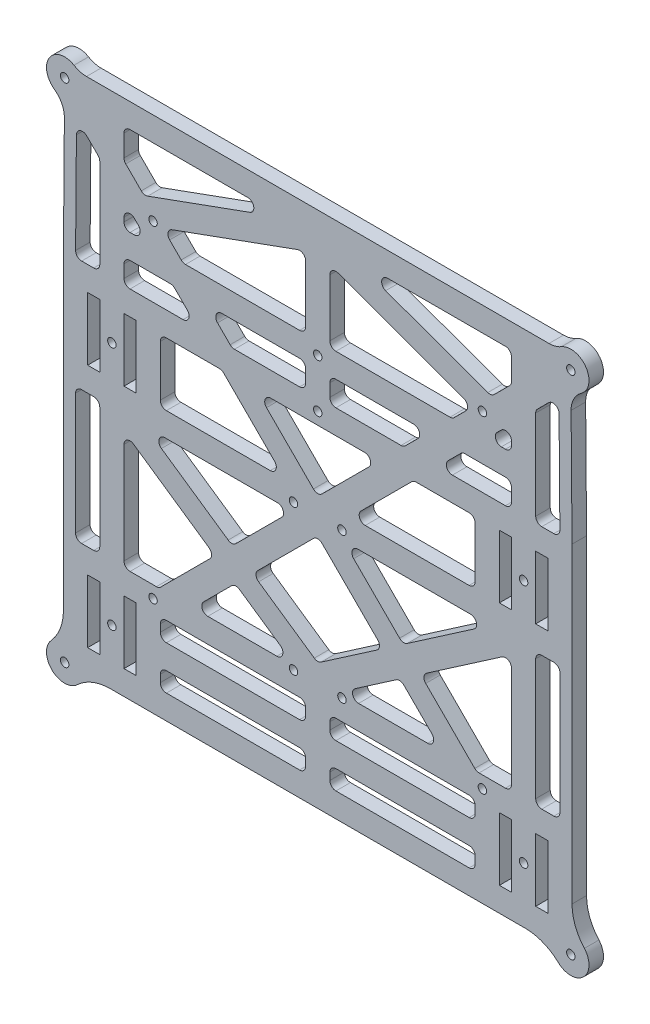
from build123d import *

# Parameters (mm, degrees)
SZKIC3_W                      = 10
SZKIC3_H                      = 209
DODANIE_WYCI_GNI_CIE1_DEPTH   = 6
DODANIE_WYCI_GNI_CIE1_2_DEPTH = 6
SZKIC4_W                      = 190
SZKIC4_H                      = 10
DODANIE_WYCI_GNI_CIE2_DEPTH   = 6
SZKIC5_W                      = 10
SZKIC5_H                      = 26
DODANIE_WYCI_GNI_CIE3_DEPTH   = 6
SZKIC6_W                      = 10
SZKIC6_H                      = 46
DODANIE_WYCI_GNI_CIE4_DEPTH   = 6
SZKIC7_R                      = 7.5
DODANIE_WYCI_GNI_CIE5_DEPTH   = 6
ZAOKR_GLENIE1_R               = 20
SZKIC8_R                      = 7.5
DODANIE_WYCI_GNI_CIE6_DEPTH   = 6
DODANIE_WYCI_GNI_CIE6_2_DEPTH = 6
SZKIC9_W                      = 209
SZKIC9_H                      = 10
DODANIE_WYCI_GNI_CIE7_DEPTH   = 6
DODANIE_WYCI_GNI_CIE8_DEPTH   = 6
SZKIC11_W                     = 160
SZKIC11_H                     = 10
SZKIC11_W_2                   = 130
DODANIE_WYCI_GNI_CIE9_DEPTH   = 6
DODANIE_WYCI_GNI_CIE10_DEPTH  = 6
DODANIE_WYCI_GNI_CIE11_DEPTH  = 6
SZKIC14_W                     = 4.999837417
SZKIC14_H                     = 55
DODANIE_WYCI_GNI_CIE12_DEPTH  = 6
SZKIC15_W                     = 10
SZKIC15_H                     = 51.681071281
DODANIE_WYCI_GNI_CIE13_DEPTH  = 6
SZKIC16_W                     = 10
SZKIC16_H                     = 26
DODANIE_WYCI_GNI_CIE14_DEPTH  = 6
DODANIE_WYCI_GNI_CIE15_DEPTH  = 6
ZAOKR_GLENIE2_R               = 2.5
ZAOKR_GLENIE3_R               = 10
WYTNIJ_WYCI_GNI_CIE1_REACH    = 160.506
SZKIC1_R                      = 1.75
WYTNIJ_WYCI_GNI_CIE2_REACH    = 160.506
SZKIC18_R                     = 1.75
WYTNIJ_WYCI_GNI_CIE3_REACH    = 160.506
SZKIC19_R                     = 1.75
WYTNIJ_WYCI_GNI_CIE4_REACH    = 160.506
SZKIC20_R                     = 1.75


with BuildPart() as part:
    # Szkic3 → Dodanie-wyciągnięcie1 (new body)
    with BuildSketch(Plane.XY):
        with Locations((-85, 0)):
            Rectangle(SZKIC3_W, SZKIC3_H)
    extrude(amount=DODANIE_WYCI_GNI_CIE1_DEPTH)



with BuildPart() as body_2:
    # Szkic3 → Dodanie-wyci_gni_cie1 2 (new body)
    with BuildSketch(Plane.XY):
        with Locations((85, 0)):
            Rectangle(SZKIC3_W, SZKIC3_H)
    extrude(amount=DODANIE_WYCI_GNI_CIE1_2_DEPTH)


with BuildPart() as part_1:
    add(part.part)

    add(body_2.part)  # Dodanie-wyciągnięcie2 merges body 2
    # Szkic4 → Dodanie-wyciągnięcie2 (add)
    with BuildSketch(Plane.XY):
        with Locations((0, -99.5)):
            Rectangle(SZKIC4_W, SZKIC4_H)
        with Locations((0, -63.5)):
            Rectangle(SZKIC4_W, SZKIC4_H)
        with Locations((0, 1.5)):
            Rectangle(SZKIC4_W, SZKIC4_H)
        with Locations((0, 37.5)):
            Rectangle(SZKIC4_W, SZKIC4_H)
    extrude(amount=DODANIE_WYCI_GNI_CIE2_DEPTH)

    # Szkic5 → Dodanie-wyciągnięcie3 (add)
    with BuildSketch(Plane.XY.offset(6)):
        with Locations((-70, -81.5)):
            Rectangle(SZKIC5_W, SZKIC5_H)
        with Locations((-70, 19.5)):
            Rectangle(SZKIC5_W, SZKIC5_H)
        with Locations((70, 19.5)):
            Rectangle(SZKIC5_W, SZKIC5_H)
        with Locations((70, -81.5)):
            Rectangle(SZKIC5_W, SZKIC5_H)
    extrude(amount=-DODANIE_WYCI_GNI_CIE3_DEPTH)

    # Szkic6 → Dodanie-wyciągnięcie4 (add)
    with BuildSketch(Plane.XY):
        with Locations((-100, 19.5)):
            Rectangle(SZKIC6_W, SZKIC6_H)
        with Locations((-100, -81.5)):
            Rectangle(SZKIC6_W, SZKIC6_H)
        with Locations((100, -81.5)):
            Rectangle(SZKIC6_W, SZKIC6_H)
        with Locations((100, 19.5)):
            Rectangle(SZKIC6_W, SZKIC6_H)
    extrude(amount=DODANIE_WYCI_GNI_CIE4_DEPTH)

    # Szkic7 → Dodanie-wyciągnięcie5 (add)
    with BuildSketch(Plane.XY.offset(6)):
        with Locations((-104.5, -104.5)):
            Circle(SZKIC7_R)
        with Locations((104.5, -104.5)):
            Circle(SZKIC7_R)
    extrude(amount=-DODANIE_WYCI_GNI_CIE5_DEPTH)

    # Zaokrąglenie1
    zaokr_glenie1_edges = [part_1.edges().sort_by_distance(p)[0] for p in [
        (-105, -97.016685226, 3),
        (-97, -104.5, 3),
        (105, -97.016685226, 3),
        (97, -104.5, 3),
    ]]
    fillet(zaokr_glenie1_edges, radius=ZAOKR_GLENIE1_R)



with BuildPart() as body_2_2:
    # Szkic8 → Dodanie-wyciągnięcie6 (new body)
    with BuildSketch(Plane.XY.offset(6)):
        with Locations((-104.5, 104.5)):
            Circle(SZKIC8_R)
    extrude(amount=-DODANIE_WYCI_GNI_CIE6_DEPTH)


with BuildPart() as body_3:
    # Szkic8 → Dodanie-wyci_gni_cie6 2 (new body)
    with BuildSketch(Plane.XY.offset(6)):
        with Locations((104.5, 104.5)):
            Circle(SZKIC8_R)
    extrude(amount=-DODANIE_WYCI_GNI_CIE6_2_DEPTH)


with BuildPart() as part_2:
    add(part_1.part)

    add(body_2_2.part)  # Dodanie-wyciągnięcie7 merges body 2 2

    add(body_3.part)  # Dodanie-wyciągnięcie7 merges body 3
    # Szkic9 → Dodanie-wyciągnięcie7 (add)
    with BuildSketch(Plane.XY):
        with Locations((0, 104.5)):
            Rectangle(SZKIC9_W, SZKIC9_H)
    extrude(amount=DODANIE_WYCI_GNI_CIE7_DEPTH)

    # Szkic10 → Dodanie-wyciągnięcie8 (add)
    with BuildSketch(Plane.XY):
        Polygon((-100.964466094, 108.035533906), (-108.035533906, 100.964466094), (-7.071067812, 0), (0, 7.071067812), align=None)
        Polygon((100.964466094, 108.035533906), (0, 7.071067812), (7.071067812, 0), (108.035533906, 100.964466094), align=None)
        Polygon((0, -7.071067812), (-7.071067812, 0), (-65.571067812, -58.5), (-51.428932188, -58.5), align=None)
        Polygon((0, 7.071067812), (-7.071067812, 0), (0, -7.071067812), (7.071067812, 0), align=None)
        Polygon((7.071067812, 0), (0, -7.071067812), (51.428932188, -58.5), (65.571067812, -58.5), align=None)
    extrude(amount=DODANIE_WYCI_GNI_CIE8_DEPTH)

    # Szkic11 → Dodanie-wyciągnięcie9 (add)
    with BuildSketch(Plane(origin=(0, 0, 0), x_dir=(-1, 0, 0), z_dir=(0, 0, -1))):
        with Locations((0, 57.714466094)):
            Rectangle(SZKIC11_W, SZKIC11_H)
        with Locations((0, -81.5)):
            Rectangle(SZKIC11_W_2, SZKIC11_H)
    extrude(amount=-DODANIE_WYCI_GNI_CIE9_DEPTH)

    # Szkic12 → Dodanie-wyciągnięcie10 (add)
    with BuildSketch(Plane(origin=(0, 0, 0), x_dir=(-1, 0, 0), z_dir=(0, 0, -1))):
        Polygon((-82.832644114, -7.620209621), (0, -64.56765245), (82.832644114, -7.620209621), (77.167355886, 0.620209621), (0, -52.43234755), (-77.167355886, 0.620209621), align=None)
    extrude(amount=-DODANIE_WYCI_GNI_CIE10_DEPTH)

    # Szkic13 → Dodanie-wyciągnięcie11 (add)
    with BuildSketch(Plane(origin=(0, 0, 0), x_dir=(-1, 0, 0), z_dir=(0, 0, -1))):
        Polygon((-63.918821819, 70.989889631), (0, 94.181071281), (63.918821819, 70.989889631), (71.724576463, 78.795644275), (0, 104.818928719), (-71.724576463, 78.795644275), align=None)
    extrude(amount=-DODANIE_WYCI_GNI_CIE11_DEPTH)

    # Szkic14 → Dodanie-wyciągnięcie12 (add)
    with BuildSketch(Plane(origin=(0, 0, 0), x_dir=(-1, 0, 0), z_dir=(0, 0, -1))):
        Polygon((99.500162583, 104.459678731), (100.000162583, 42.459678731), (105, 42.5), (104.5, 104.5), align=None)
        Polygon((-99.500162583, 104.459678731), (-100.000162583, 42.459678731), (-105, 42.5), (-104.5, 104.5), align=None)
        with Locations((102.500081292, -31)):
            Rectangle(SZKIC14_W, SZKIC14_H)
        with Locations((-102.500081292, -31)):
            Rectangle(SZKIC14_W, SZKIC14_H)
    extrude(amount=-DODANIE_WYCI_GNI_CIE12_DEPTH)

    # Szkic15 → Dodanie-wyciągnięcie13 (add)
    with BuildSketch(Plane(origin=(0, 0, 0), x_dir=(-1, 0, 0), z_dir=(0, 0, -1))):
        with Locations((0, 68.340535641)):
            Rectangle(SZKIC15_W, SZKIC15_H)
    extrude(amount=-DODANIE_WYCI_GNI_CIE13_DEPTH)

    # Szkic16 → Dodanie-wyciągnięcie14 (add)
    with BuildSketch(Plane(origin=(0, 0, 0), x_dir=(-1, 0, 0), z_dir=(0, 0, -1))):
        with Locations((0, -81.5)):
            Rectangle(SZKIC16_W, SZKIC16_H)
    extrude(amount=-DODANIE_WYCI_GNI_CIE14_DEPTH)

    # Szkic17 → Dodanie-wyciągnięcie15 (add)
    with BuildSketch(Plane.XY.offset(6)):
        Polygon((-90, 97.071067812), (-90, 99.5), (-92.428932188, 99.5), align=None)
        Polygon((92.428932188, 99.5), (90, 99.5), (90, 97.071067812), align=None)
    extrude(amount=-DODANIE_WYCI_GNI_CIE15_DEPTH)

    # Zaokrąglenie2
    zaokr_glenie2_edges = [part_2.edges().sort_by_distance(p)[0] for p in [
        (-5, -76.5, 3),
        (-5, -68.5, 3),
        (5, -76.5, 3),
        (5, -68.5, 3),
        (-5, -94.5, 3),
        (5, -94.5, 3),
        (-90, -3.5, 3),
        (90, -3.5, 3),
        (-90, 42.5, 3),
        (-80, 42.5, 3),
        (80, 42.5, 3),
        (90, 42.5, 3),
        (-65, -68.5, 3),
        (-65, -94.5, 3),
        (-65, 32.5, 3),
        (-65, 6.5, 3),
        (65, 6.5, 3),
        (65, 32.5, 3),
        (65, -94.5, 3),
        (65, -68.5, 3),
        (-80, 99.5, 3),
        (80, 99.5, 3),
        (-10.571067812, -3.5, 3),
        (10.571067812, -3.5, 3),
        (65.571067812, -58.5, 3),
        (0, 7.071067812, 3),
        (-80, 87.071067812, 3),
        (-25.428932188, 32.5, 3),
        (-35.428932188, 42.5, 3),
        (80, 87.071067812, 3),
        (35.428932188, 42.5, 3),
        (25.428932188, 32.5, 3),
        (-90, 82.928932188, 3),
        (-80, 72.928932188, 3),
        (-49.571067812, 42.5, 3),
        (-13.571067812, 6.5, 3),
        (-39.571067812, 32.5, 3),
        (13.571067812, 6.5, 3),
        (80, 72.928932188, 3),
        (90, 82.928932188, 3),
        (39.571067812, 32.5, 3),
        (49.571067812, 42.5, 3),
        (51.428932188, -58.5, 3),
        (0, -7.071067812, 3),
        (-51.428932188, -58.5, 3),
        (-65.571067812, -58.5, 3),
        (90, -58.5, 3),
        (-69.785533906, 62.714466094, 3),
        (-59.785533906, 52.714466094, 3),
        (45.643398282, 52.714466094, 3),
        (-45.643398282, 52.714466094, 3),
        (-80, 52.714466094, 3),
        (55.643398282, 62.714466094, 3),
        (-55.643398282, 62.714466094, 3),
        (-80, 62.714466094, 3),
        (59.785533906, 52.714466094, 3),
        (80, 52.714466094, 3),
        (69.785533906, 62.714466094, 3),
        (80, 62.714466094, 3),
        (65, -86.5, 3),
        (65, -76.5, 3),
        (-65, -76.5, 3),
        (-65, -86.5, 3),
        (34.072050156, -41.143117968, 3),
        (26.880758364, -33.951826175, 3),
        (-34.072050156, -41.143117968, 3),
        (-90, -58.5, 3),
        (-26.880758364, -33.951826175, 3),
        (-80, -58.5, 3),
        (80, -58.5, 3),
        (-71.17432371, -3.5, 3),
        (-35.261283178, -28.190215366, 3),
        (-80, -9.56765245, 3),
        (-42.45257497, -35.381507158, 3),
        (35.261283178, -28.190215366, 3),
        (42.45257497, -35.381507158, 3),
        (8.82567629, -58.5, 3),
        (71.17432371, -3.5, 3),
        (0, -52.43234755, 3),
        (-8.82567629, -58.5, 3),
        (80, -9.56765245, 3),
        (71.724576463, 78.795644275, 3),
        (-63.918821819, 70.989889631, 3),
        (63.918821819, 70.989889631, 3),
        (14.659867798, 99.5, 3),
        (-14.659867798, 99.5, 3),
        (-71.724576463, 78.795644275, 3),
        (99.596407255, 92.525339443, 3),
        (99.999837412, 42.5, 3),
        (-99.596407255, 92.525339443, 3),
        (-99.999837412, 42.5, 3),
        (-100.000162583, -3.5, 3),
        (-100.000162583, -58.5, 3),
        (100.000162583, -58.5, 3),
        (100.000162583, -3.5, 3),
        (5, 92.366959178, 3),
        (-5, 92.366959178, 3),
        (-5, 62.714466094, 3),
        (5, 62.714466094, 3),
        (-5, 52.714466094, 3),
        (-5, 42.5, 3),
        (5, 52.714466094, 3),
        (5, 42.5, 3),
        (5, -86.5, 3),
        (-5, -86.5, 3),
    ]]
    fillet(zaokr_glenie2_edges, radius=ZAOKR_GLENIE2_R)

    # Zaokrąglenie3
    zaokr_glenie3_edges = [part_2.edges().sort_by_distance(p)[0] for p in [
        (-98.909830056, 109.5, 3),
        (98.909830056, 109.5, 3),
        (104.560481904, 97.000243875, 3),
        (-104.560481904, 97.000243875, 3),
    ]]
    fillet(zaokr_glenie3_edges, radius=ZAOKR_GLENIE3_R)

    # Szkic1 → Wytnij-wyciągnięcie1 (cut, up to next)
    with BuildSketch(Plane.XY, mode=Mode.PRIVATE) as wytnij_wyci_gni_cie1_sk1:
        with Locations(Location((-104.5, 104.5, 0), (0, 0, 180))):
            Circle(SZKIC1_R)
    wytnij_wyci_gni_cie1_tool1 = extrude(wytnij_wyci_gni_cie1_sk1.sketch, amount=WYTNIJ_WYCI_GNI_CIE1_REACH, mode=Mode.PRIVATE) & part_2.part
    # Szkic1 → Wytnij-wyciągnięcie1 (cut, up to next)
    with BuildSketch(Plane.XY, mode=Mode.PRIVATE) as wytnij_wyci_gni_cie1_sk2:
        with Locations(Location((104.5, 104.5, 0), (0, 0, 180))):
            Circle(SZKIC1_R)
    wytnij_wyci_gni_cie1_tool2 = extrude(wytnij_wyci_gni_cie1_sk2.sketch, amount=WYTNIJ_WYCI_GNI_CIE1_REACH, mode=Mode.PRIVATE) & part_2.part
    # Szkic1 → Wytnij-wyciągnięcie1 (cut, up to next)
    with BuildSketch(Plane.XY, mode=Mode.PRIVATE) as wytnij_wyci_gni_cie1_sk3:
        with Locations(Location((104.5, -104.5, 0), (0, 0, 180))):
            Circle(SZKIC1_R)
    wytnij_wyci_gni_cie1_tool3 = extrude(wytnij_wyci_gni_cie1_sk3.sketch, amount=WYTNIJ_WYCI_GNI_CIE1_REACH, mode=Mode.PRIVATE) & part_2.part
    # Szkic1 → Wytnij-wyciągnięcie1 (cut, up to next)
    with BuildSketch(Plane.XY, mode=Mode.PRIVATE) as wytnij_wyci_gni_cie1_sk4:
        with Locations(Location((-104.5, -104.5, 0), (0, 0, 180))):
            Circle(SZKIC1_R)
    wytnij_wyci_gni_cie1_tool4 = extrude(wytnij_wyci_gni_cie1_sk4.sketch, amount=WYTNIJ_WYCI_GNI_CIE1_REACH, mode=Mode.PRIVATE) & part_2.part
    add(wytnij_wyci_gni_cie1_tool1.solids().sort_by_distance((-104.5, 104.5, 0))[0], mode=Mode.SUBTRACT)
    add(wytnij_wyci_gni_cie1_tool2.solids().sort_by_distance((104.5, 104.5, 0))[0], mode=Mode.SUBTRACT)
    add(wytnij_wyci_gni_cie1_tool3.solids().sort_by_distance((104.5, -104.5, 0))[0], mode=Mode.SUBTRACT)
    add(wytnij_wyci_gni_cie1_tool4.solids().sort_by_distance((-104.5, -104.5, 0))[0], mode=Mode.SUBTRACT)

    # Szkic18 → Wytnij-wyciągnięcie2 (cut, up to next)
    with BuildSketch(Plane(origin=(0, 0, 0), x_dir=(-1, 0, 0), z_dir=(0, 0, -1)), mode=Mode.PRIVATE) as wytnij_wyci_gni_cie2_sk1:
        with Locations((-68, -63.5)):
            Circle(SZKIC18_R)
    wytnij_wyci_gni_cie2_tool1 = extrude(wytnij_wyci_gni_cie2_sk1.sketch, amount=-WYTNIJ_WYCI_GNI_CIE2_REACH, mode=Mode.PRIVATE) & part_2.part
    # Szkic18 → Wytnij-wyciągnięcie2 (cut, up to next)
    with BuildSketch(Plane(origin=(0, 0, 0), x_dir=(-1, 0, 0), z_dir=(0, 0, -1)), mode=Mode.PRIVATE) as wytnij_wyci_gni_cie2_sk2:
        with Locations((-68, 71.5)):
            Circle(SZKIC18_R)
    wytnij_wyci_gni_cie2_tool2 = extrude(wytnij_wyci_gni_cie2_sk2.sketch, amount=-WYTNIJ_WYCI_GNI_CIE2_REACH, mode=Mode.PRIVATE) & part_2.part
    # Szkic18 → Wytnij-wyciągnięcie2 (cut, up to next)
    with BuildSketch(Plane(origin=(0, 0, 0), x_dir=(-1, 0, 0), z_dir=(0, 0, -1)), mode=Mode.PRIVATE) as wytnij_wyci_gni_cie2_sk3:
        with Locations((68, -63.5)):
            Circle(SZKIC18_R)
    wytnij_wyci_gni_cie2_tool3 = extrude(wytnij_wyci_gni_cie2_sk3.sketch, amount=-WYTNIJ_WYCI_GNI_CIE2_REACH, mode=Mode.PRIVATE) & part_2.part
    # Szkic18 → Wytnij-wyciągnięcie2 (cut, up to next)
    with BuildSketch(Plane(origin=(0, 0, 0), x_dir=(-1, 0, 0), z_dir=(0, 0, -1)), mode=Mode.PRIVATE) as wytnij_wyci_gni_cie2_sk4:
        with Locations((68, 71.5)):
            Circle(SZKIC18_R)
    wytnij_wyci_gni_cie2_tool4 = extrude(wytnij_wyci_gni_cie2_sk4.sketch, amount=-WYTNIJ_WYCI_GNI_CIE2_REACH, mode=Mode.PRIVATE) & part_2.part
    add(wytnij_wyci_gni_cie2_tool1.solids().sort_by_distance((68, -63.5, 0))[0], mode=Mode.SUBTRACT)
    add(wytnij_wyci_gni_cie2_tool2.solids().sort_by_distance((68, 71.5, 0))[0], mode=Mode.SUBTRACT)
    add(wytnij_wyci_gni_cie2_tool3.solids().sort_by_distance((-68, -63.5, 0))[0], mode=Mode.SUBTRACT)
    add(wytnij_wyci_gni_cie2_tool4.solids().sort_by_distance((-68, 71.5, 0))[0], mode=Mode.SUBTRACT)

    # Szkic19 → Wytnij-wyciągnięcie3 (cut, up to next)
    with BuildSketch(Plane(origin=(0, 0, 0), x_dir=(-1, 0, 0), z_dir=(0, 0, -1)), mode=Mode.PRIVATE) as wytnij_wyci_gni_cie3_sk1:
        with Locations((-85, 19.5)):
            Circle(SZKIC19_R)
    wytnij_wyci_gni_cie3_tool1 = extrude(wytnij_wyci_gni_cie3_sk1.sketch, amount=-WYTNIJ_WYCI_GNI_CIE3_REACH, mode=Mode.PRIVATE) & part_2.part
    # Szkic19 → Wytnij-wyciągnięcie3 (cut, up to next)
    with BuildSketch(Plane(origin=(0, 0, 0), x_dir=(-1, 0, 0), z_dir=(0, 0, -1)), mode=Mode.PRIVATE) as wytnij_wyci_gni_cie3_sk2:
        with Locations((85, 19.5)):
            Circle(SZKIC19_R)
    wytnij_wyci_gni_cie3_tool2 = extrude(wytnij_wyci_gni_cie3_sk2.sketch, amount=-WYTNIJ_WYCI_GNI_CIE3_REACH, mode=Mode.PRIVATE) & part_2.part
    # Szkic19 → Wytnij-wyciągnięcie3 (cut, up to next)
    with BuildSketch(Plane(origin=(0, 0, 0), x_dir=(-1, 0, 0), z_dir=(0, 0, -1)), mode=Mode.PRIVATE) as wytnij_wyci_gni_cie3_sk3:
        with Locations((85, -81.5)):
            Circle(SZKIC19_R)
    wytnij_wyci_gni_cie3_tool3 = extrude(wytnij_wyci_gni_cie3_sk3.sketch, amount=-WYTNIJ_WYCI_GNI_CIE3_REACH, mode=Mode.PRIVATE) & part_2.part
    # Szkic19 → Wytnij-wyciągnięcie3 (cut, up to next)
    with BuildSketch(Plane(origin=(0, 0, 0), x_dir=(-1, 0, 0), z_dir=(0, 0, -1)), mode=Mode.PRIVATE) as wytnij_wyci_gni_cie3_sk4:
        with Locations((-85, -81.5)):
            Circle(SZKIC19_R)
    wytnij_wyci_gni_cie3_tool4 = extrude(wytnij_wyci_gni_cie3_sk4.sketch, amount=-WYTNIJ_WYCI_GNI_CIE3_REACH, mode=Mode.PRIVATE) & part_2.part
    add(wytnij_wyci_gni_cie3_tool1.solids().sort_by_distance((85, 19.5, 0))[0], mode=Mode.SUBTRACT)
    add(wytnij_wyci_gni_cie3_tool2.solids().sort_by_distance((-85, 19.5, 0))[0], mode=Mode.SUBTRACT)
    add(wytnij_wyci_gni_cie3_tool3.solids().sort_by_distance((-85, -81.5, 0))[0], mode=Mode.SUBTRACT)
    add(wytnij_wyci_gni_cie3_tool4.solids().sort_by_distance((85, -81.5, 0))[0], mode=Mode.SUBTRACT)

    # Szkic20 → Wytnij-wyciągnięcie4 (cut, up to next)
    with BuildSketch(Plane.XY.offset(6), mode=Mode.PRIVATE) as wytnij_wyci_gni_cie4_sk1:
        with Locations((10, 0)):
            Circle(SZKIC20_R)
    wytnij_wyci_gni_cie4_tool1 = extrude(wytnij_wyci_gni_cie4_sk1.sketch, amount=-WYTNIJ_WYCI_GNI_CIE4_REACH, mode=Mode.PRIVATE) & part_2.part
    # Szkic20 → Wytnij-wyciągnięcie4 (cut, up to next)
    with BuildSketch(Plane.XY.offset(6), mode=Mode.PRIVATE) as wytnij_wyci_gni_cie4_sk2:
        with Locations((-10, 0)):
            Circle(SZKIC20_R)
    wytnij_wyci_gni_cie4_tool2 = extrude(wytnij_wyci_gni_cie4_sk2.sketch, amount=-WYTNIJ_WYCI_GNI_CIE4_REACH, mode=Mode.PRIVATE) & part_2.part
    # Szkic20 → Wytnij-wyciągnięcie4 (cut, up to next)
    with BuildSketch(Plane.XY.offset(6), mode=Mode.PRIVATE) as wytnij_wyci_gni_cie4_sk3:
        with Locations((0, 57.5)):
            Circle(SZKIC20_R)
    wytnij_wyci_gni_cie4_tool3 = extrude(wytnij_wyci_gni_cie4_sk3.sketch, amount=-WYTNIJ_WYCI_GNI_CIE4_REACH, mode=Mode.PRIVATE) & part_2.part
    # Szkic20 → Wytnij-wyciągnięcie4 (cut, up to next)
    with BuildSketch(Plane.XY.offset(6), mode=Mode.PRIVATE) as wytnij_wyci_gni_cie4_sk4:
        with Locations((0, 37.5)):
            Circle(SZKIC20_R)
    wytnij_wyci_gni_cie4_tool4 = extrude(wytnij_wyci_gni_cie4_sk4.sketch, amount=-WYTNIJ_WYCI_GNI_CIE4_REACH, mode=Mode.PRIVATE) & part_2.part
    # Szkic20 → Wytnij-wyciągnięcie4 (cut, up to next)
    with BuildSketch(Plane.XY.offset(6), mode=Mode.PRIVATE) as wytnij_wyci_gni_cie4_sk5:
        with Locations((10, -60)):
            Circle(SZKIC20_R)
    wytnij_wyci_gni_cie4_tool5 = extrude(wytnij_wyci_gni_cie4_sk5.sketch, amount=-WYTNIJ_WYCI_GNI_CIE4_REACH, mode=Mode.PRIVATE) & part_2.part
    # Szkic20 → Wytnij-wyciągnięcie4 (cut, up to next)
    with BuildSketch(Plane.XY.offset(6), mode=Mode.PRIVATE) as wytnij_wyci_gni_cie4_sk6:
        with Locations((-10, -60)):
            Circle(SZKIC20_R)
    wytnij_wyci_gni_cie4_tool6 = extrude(wytnij_wyci_gni_cie4_sk6.sketch, amount=-WYTNIJ_WYCI_GNI_CIE4_REACH, mode=Mode.PRIVATE) & part_2.part
    add(wytnij_wyci_gni_cie4_tool1.solids().sort_by_distance((10, 0, 6))[0], mode=Mode.SUBTRACT)
    add(wytnij_wyci_gni_cie4_tool2.solids().sort_by_distance((-10, 0, 6))[0], mode=Mode.SUBTRACT)
    add(wytnij_wyci_gni_cie4_tool3.solids().sort_by_distance((0, 57.5, 6))[0], mode=Mode.SUBTRACT)
    add(wytnij_wyci_gni_cie4_tool4.solids().sort_by_distance((0, 37.5, 6))[0], mode=Mode.SUBTRACT)
    add(wytnij_wyci_gni_cie4_tool5.solids().sort_by_distance((10, -60, 6))[0], mode=Mode.SUBTRACT)
    add(wytnij_wyci_gni_cie4_tool6.solids().sort_by_distance((-10, -60, 6))[0], mode=Mode.SUBTRACT)


solid = part_2.part
